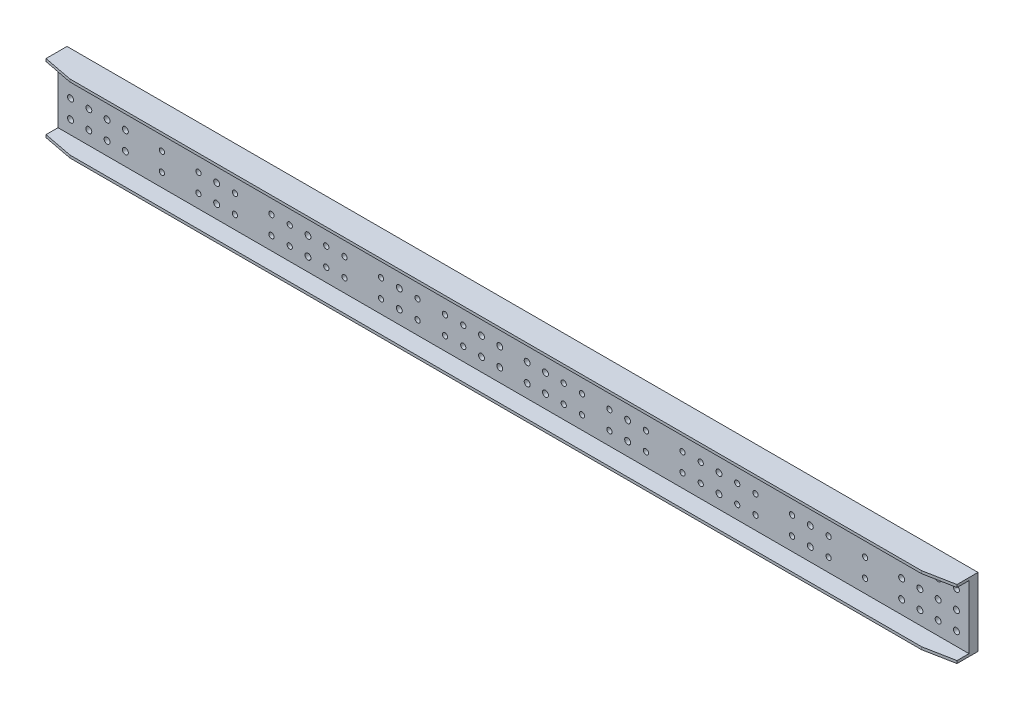
from build123d import *

# Parameters (mm, degrees)
SKETCH_1_W          = 3990
SKETCH_1_H          = 300
SKETCH_1_R          = 13
SKETCH_1_R_2        = 11.5
EXTRUDE_1534_DEPTH  = 39.5
SKETCH_2_W          = 3990
SKETCH_2_H          = 11.5
EXTRUDE_1_DEPTH     = 77.5
SKETCH_3_W          = 70
SKETCH_3_H          = 230
EXTRUDE_2_DEPTH     = 16
SKETCH_4_R          = 13
CUT_EXTRUDE_1_DEPTH = 2003.131676489
CUT_EXTRUDE_2_DEPTH = 2021.820130541


with BuildPart() as part:
    # 草图1 → Extrude 1534 (new body)
    with BuildSketch(Plane.XY):
        Rectangle(SKETCH_1_W, SKETCH_1_H)
        with Locations((1940, 80)):
            Circle(SKETCH_1_R, mode=Mode.SUBTRACT)
        with Locations((1860, 80)):
            Circle(SKETCH_1_R, mode=Mode.SUBTRACT)
        with Locations((1780, 80)):
            Circle(SKETCH_1_R, mode=Mode.SUBTRACT)
        with Locations((1700, 80)):
            Circle(SKETCH_1_R, mode=Mode.SUBTRACT)
        with Locations((1540, 80)):
            Circle(SKETCH_1_R_2, mode=Mode.SUBTRACT)
        with Locations((1380, 80)):
            Circle(SKETCH_1_R_2, mode=Mode.SUBTRACT)
        with Locations((1220, 80)):
            Circle(SKETCH_1_R_2, mode=Mode.SUBTRACT)
        with Locations((1060, 80)):
            Circle(SKETCH_1_R_2, mode=Mode.SUBTRACT)
        with Locations((980, 80)):
            Circle(SKETCH_1_R_2, mode=Mode.SUBTRACT)
        with Locations((820, 80)):
            Circle(SKETCH_1_R_2, mode=Mode.SUBTRACT)
        with Locations((740, 80)):
            Circle(SKETCH_1_R_2, mode=Mode.SUBTRACT)
        with Locations((580, 80)):
            Circle(SKETCH_1_R_2, mode=Mode.SUBTRACT)
        with Locations((980, 0)):
            Circle(SKETCH_1_R_2, mode=Mode.SUBTRACT)
        with Locations((1060, 0)):
            Circle(SKETCH_1_R_2, mode=Mode.SUBTRACT)
        with Locations((820, 0)):
            Circle(SKETCH_1_R_2, mode=Mode.SUBTRACT)
        with Locations((740, 0)):
            Circle(SKETCH_1_R_2, mode=Mode.SUBTRACT)
        with Locations((580, 0)):
            Circle(SKETCH_1_R_2, mode=Mode.SUBTRACT)
        with Locations((1220, 0)):
            Circle(SKETCH_1_R_2, mode=Mode.SUBTRACT)
        with Locations((1380, 0)):
            Circle(SKETCH_1_R_2, mode=Mode.SUBTRACT)
        with Locations((1540, 0)):
            Circle(SKETCH_1_R_2, mode=Mode.SUBTRACT)
        with Locations((1700, 0)):
            Circle(SKETCH_1_R, mode=Mode.SUBTRACT)
        with Locations((1780, 0)):
            Circle(SKETCH_1_R, mode=Mode.SUBTRACT)
        with Locations((1860, 0)):
            Circle(SKETCH_1_R, mode=Mode.SUBTRACT)
        with Locations((1940, 0)):
            Circle(SKETCH_1_R, mode=Mode.SUBTRACT)
        with Locations((420, 80)):
            Circle(SKETCH_1_R_2, mode=Mode.SUBTRACT)
        with Locations((420, 0)):
            Circle(SKETCH_1_R_2, mode=Mode.SUBTRACT)
        with Locations((300, 0)):
            Circle(SKETCH_1_R_2, mode=Mode.SUBTRACT)
        with Locations((300, 80)):
            Circle(SKETCH_1_R_2, mode=Mode.SUBTRACT)
        with Locations((220, 80)):
            Circle(SKETCH_1_R_2, mode=Mode.SUBTRACT)
        with Locations((220, 0)):
            Circle(SKETCH_1_R_2, mode=Mode.SUBTRACT)
        with Locations((140, 0)):
            Circle(SKETCH_1_R, mode=Mode.SUBTRACT)
        with Locations((140, 80)):
            Circle(SKETCH_1_R, mode=Mode.SUBTRACT)
        with Locations((60, 80)):
            Circle(SKETCH_1_R, mode=Mode.SUBTRACT)
        with Locations((60, 0)):
            Circle(SKETCH_1_R, mode=Mode.SUBTRACT)
        with Locations((1700, -80)):
            Circle(SKETCH_1_R, mode=Mode.SUBTRACT)
        with Locations((1780, -80)):
            Circle(SKETCH_1_R, mode=Mode.SUBTRACT)
        with Locations((1860, -80)):
            Circle(SKETCH_1_R, mode=Mode.SUBTRACT)
        with Locations((1940, -80)):
            Circle(SKETCH_1_R, mode=Mode.SUBTRACT)
        with Locations((580, -80)):
            Circle(SKETCH_1_R_2, mode=Mode.SUBTRACT)
        with Locations((740, -80)):
            Circle(SKETCH_1_R_2, mode=Mode.SUBTRACT)
        with Locations((820, -80)):
            Circle(SKETCH_1_R_2, mode=Mode.SUBTRACT)
        with Locations((980, -80)):
            Circle(SKETCH_1_R_2, mode=Mode.SUBTRACT)
        with Locations((1060, -80)):
            Circle(SKETCH_1_R_2, mode=Mode.SUBTRACT)
        with Locations((1220, -80)):
            Circle(SKETCH_1_R_2, mode=Mode.SUBTRACT)
        with Locations((1380, -80)):
            Circle(SKETCH_1_R_2, mode=Mode.SUBTRACT)
        with Locations((1540, -80)):
            Circle(SKETCH_1_R_2, mode=Mode.SUBTRACT)
        with Locations((220, -80)):
            Circle(SKETCH_1_R_2, mode=Mode.SUBTRACT)
        with Locations((300, -80)):
            Circle(SKETCH_1_R_2, mode=Mode.SUBTRACT)
        with Locations((420, -80)):
            Circle(SKETCH_1_R_2, mode=Mode.SUBTRACT)
        with Locations((60, -80)):
            Circle(SKETCH_1_R, mode=Mode.SUBTRACT)
        with Locations((140, -80)):
            Circle(SKETCH_1_R, mode=Mode.SUBTRACT)
        with Locations((-140, -80)):
            Circle(SKETCH_1_R, mode=Mode.SUBTRACT)
        with Locations((-60, -80)):
            Circle(SKETCH_1_R, mode=Mode.SUBTRACT)
        with Locations((-580, -80)):
            Circle(SKETCH_1_R_2, mode=Mode.SUBTRACT)
        with Locations((-420, -80)):
            Circle(SKETCH_1_R_2, mode=Mode.SUBTRACT)
        with Locations((-300, -80)):
            Circle(SKETCH_1_R_2, mode=Mode.SUBTRACT)
        with Locations((-220, -80)):
            Circle(SKETCH_1_R_2, mode=Mode.SUBTRACT)
        with Locations((-1540, -80)):
            Circle(SKETCH_1_R_2, mode=Mode.SUBTRACT)
        with Locations((-1380, -80)):
            Circle(SKETCH_1_R_2, mode=Mode.SUBTRACT)
        with Locations((-1220, -80)):
            Circle(SKETCH_1_R_2, mode=Mode.SUBTRACT)
        with Locations((-1060, -80)):
            Circle(SKETCH_1_R_2, mode=Mode.SUBTRACT)
        with Locations((-980, -80)):
            Circle(SKETCH_1_R_2, mode=Mode.SUBTRACT)
        with Locations((-820, -80)):
            Circle(SKETCH_1_R_2, mode=Mode.SUBTRACT)
        with Locations((-740, -80)):
            Circle(SKETCH_1_R_2, mode=Mode.SUBTRACT)
        with Locations((-1940, -80)):
            Circle(SKETCH_1_R, mode=Mode.SUBTRACT)
        with Locations((-1860, -80)):
            Circle(SKETCH_1_R, mode=Mode.SUBTRACT)
        with Locations((-1780, -80)):
            Circle(SKETCH_1_R, mode=Mode.SUBTRACT)
        with Locations((-1700, -80)):
            Circle(SKETCH_1_R, mode=Mode.SUBTRACT)
        with Locations((-60, 0)):
            Circle(SKETCH_1_R, mode=Mode.SUBTRACT)
        with Locations((-60, 80)):
            Circle(SKETCH_1_R, mode=Mode.SUBTRACT)
        with Locations((-140, 80)):
            Circle(SKETCH_1_R, mode=Mode.SUBTRACT)
        with Locations((-140, 0)):
            Circle(SKETCH_1_R, mode=Mode.SUBTRACT)
        with Locations((-220, 0)):
            Circle(SKETCH_1_R_2, mode=Mode.SUBTRACT)
        with Locations((-220, 80)):
            Circle(SKETCH_1_R_2, mode=Mode.SUBTRACT)
        with Locations((-300, 80)):
            Circle(SKETCH_1_R_2, mode=Mode.SUBTRACT)
        with Locations((-300, 0)):
            Circle(SKETCH_1_R_2, mode=Mode.SUBTRACT)
        with Locations((-420, 0)):
            Circle(SKETCH_1_R_2, mode=Mode.SUBTRACT)
        with Locations((-420, 80)):
            Circle(SKETCH_1_R_2, mode=Mode.SUBTRACT)
        with Locations((-1940, 0)):
            Circle(SKETCH_1_R, mode=Mode.SUBTRACT)
        with Locations((-1860, 0)):
            Circle(SKETCH_1_R, mode=Mode.SUBTRACT)
        with Locations((-1780, 0)):
            Circle(SKETCH_1_R, mode=Mode.SUBTRACT)
        with Locations((-1700, 0)):
            Circle(SKETCH_1_R, mode=Mode.SUBTRACT)
        with Locations((-1540, 0)):
            Circle(SKETCH_1_R_2, mode=Mode.SUBTRACT)
        with Locations((-1380, 0)):
            Circle(SKETCH_1_R_2, mode=Mode.SUBTRACT)
        with Locations((-1220, 0)):
            Circle(SKETCH_1_R_2, mode=Mode.SUBTRACT)
        with Locations((-580, 0)):
            Circle(SKETCH_1_R_2, mode=Mode.SUBTRACT)
        with Locations((-740, 0)):
            Circle(SKETCH_1_R_2, mode=Mode.SUBTRACT)
        with Locations((-820, 0)):
            Circle(SKETCH_1_R_2, mode=Mode.SUBTRACT)
        with Locations((-1060, 0)):
            Circle(SKETCH_1_R_2, mode=Mode.SUBTRACT)
        with Locations((-980, 0)):
            Circle(SKETCH_1_R_2, mode=Mode.SUBTRACT)
        with Locations((-580, 80)):
            Circle(SKETCH_1_R_2, mode=Mode.SUBTRACT)
        with Locations((-740, 80)):
            Circle(SKETCH_1_R_2, mode=Mode.SUBTRACT)
        with Locations((-820, 80)):
            Circle(SKETCH_1_R_2, mode=Mode.SUBTRACT)
        with Locations((-980, 80)):
            Circle(SKETCH_1_R_2, mode=Mode.SUBTRACT)
        with Locations((-1060, 80)):
            Circle(SKETCH_1_R_2, mode=Mode.SUBTRACT)
        with Locations((-1220, 80)):
            Circle(SKETCH_1_R_2, mode=Mode.SUBTRACT)
        with Locations((-1380, 80)):
            Circle(SKETCH_1_R_2, mode=Mode.SUBTRACT)
        with Locations((-1540, 80)):
            Circle(SKETCH_1_R_2, mode=Mode.SUBTRACT)
        with Locations((-1700, 80)):
            Circle(SKETCH_1_R, mode=Mode.SUBTRACT)
        with Locations((-1780, 80)):
            Circle(SKETCH_1_R, mode=Mode.SUBTRACT)
        with Locations((-1860, 80)):
            Circle(SKETCH_1_R, mode=Mode.SUBTRACT)
        with Locations((-1940, 80)):
            Circle(SKETCH_1_R, mode=Mode.SUBTRACT)
    extrude(amount=EXTRUDE_1534_DEPTH)

    # 草图2 → 凸台-拉伸1 (add)
    with BuildSketch(Plane.XY.offset(39.5)):
        with Locations((0, 144.25)):
            Rectangle(SKETCH_2_W, SKETCH_2_H)
        with Locations((0, -144.25)):
            Rectangle(SKETCH_2_W, SKETCH_2_H)
    extrude(amount=EXTRUDE_1_DEPTH)

    # 草图3 → 凸台-拉伸2 (add)
    with BuildSketch(Plane(origin=(0, 0, 0), x_dir=(-1, 0, 0), z_dir=(0, 0, -1))):
        with Locations((1300, 0)):
            Rectangle(SKETCH_3_W, SKETCH_3_H)
        with Locations((900, 0)):
            Rectangle(SKETCH_3_W, SKETCH_3_H)
        with Locations((-1300, 0)):
            Rectangle(SKETCH_3_W, SKETCH_3_H)
        with Locations((500, 0)):
            Rectangle(SKETCH_3_W, SKETCH_3_H)
        with Locations((-900, 0)):
            Rectangle(SKETCH_3_W, SKETCH_3_H)
        with Locations((-500, 0)):
            Rectangle(SKETCH_3_W, SKETCH_3_H)
    extrude(amount=EXTRUDE_2_DEPTH)

    # 草图4 → 切除-拉伸1 (cut, through all)
    with BuildSketch(Plane.XY.offset(39.5)):
        with Locations((1300, 80)):
            Circle(SKETCH_4_R)
        with Locations((900, 80)):
            Circle(SKETCH_4_R)
        with Locations((900, 0)):
            Circle(SKETCH_4_R)
        with Locations((1300, 0)):
            Circle(SKETCH_4_R)
        with Locations((900, -80)):
            Circle(SKETCH_4_R)
        with Locations((1300, -80)):
            Circle(SKETCH_4_R)
        with Locations((500, 80)):
            Circle(SKETCH_4_R)
        with Locations((500, 0)):
            Circle(SKETCH_4_R)
        with Locations((500, -80)):
            Circle(SKETCH_4_R)
        with Locations((-500, -80)):
            Circle(SKETCH_4_R)
        with Locations((-500, 0)):
            Circle(SKETCH_4_R)
        with Locations((-500, 80)):
            Circle(SKETCH_4_R)
        with Locations((-1300, -80)):
            Circle(SKETCH_4_R)
        with Locations((-900, -80)):
            Circle(SKETCH_4_R)
        with Locations((-1300, 0)):
            Circle(SKETCH_4_R)
        with Locations((-900, 0)):
            Circle(SKETCH_4_R)
        with Locations((-900, 80)):
            Circle(SKETCH_4_R)
        with Locations((-1300, 80)):
            Circle(SKETCH_4_R)
    extrude(amount=-CUT_EXTRUDE_1_DEPTH, mode=Mode.SUBTRACT)

    # 草图5 → 切除-拉伸2 (cut, through all)
    with BuildSketch(Plane(origin=(0, 150, 0), x_dir=(-1, 0, 0), z_dir=(0, 1, 0))):
        Polygon((-1995, 92), (-1995, 117), (-1865, 117), align=None)
        Polygon((1865, 117), (1995, 92), (1995, 117), align=None)
    extrude(amount=-CUT_EXTRUDE_2_DEPTH, mode=Mode.SUBTRACT)


solid = part.part
